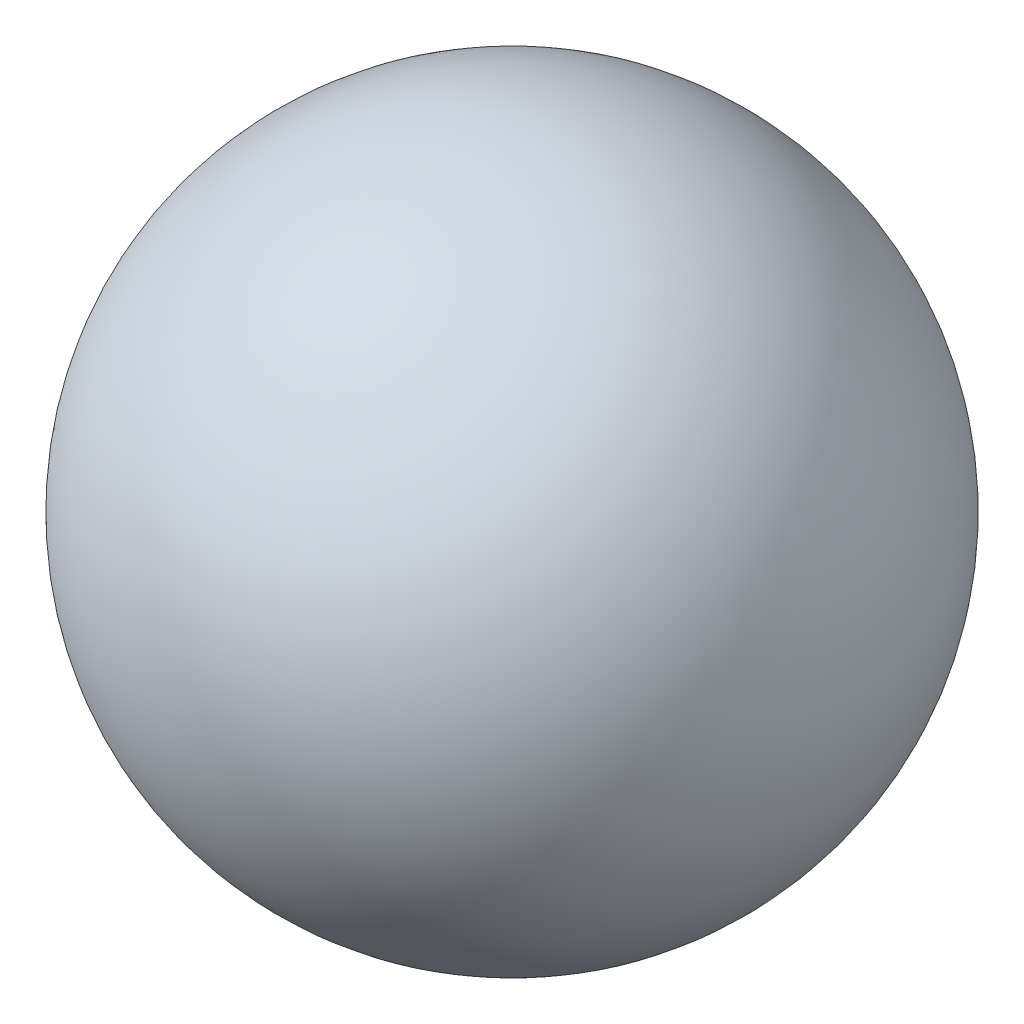
from build123d import *


with BuildPart() as part:
    # Sketch1 → Revolve1 (revolve)
    with BuildSketch(Plane.XY):
        with BuildLine():
            Line((0, 63), (0, 0))
            ThreePointArc((0, 0), (31.5, 31.5), (0, 63))
        make_face()
    revolve(axis=Axis((0, 63, 0), (0, -1, 0)))


solid = part.part
